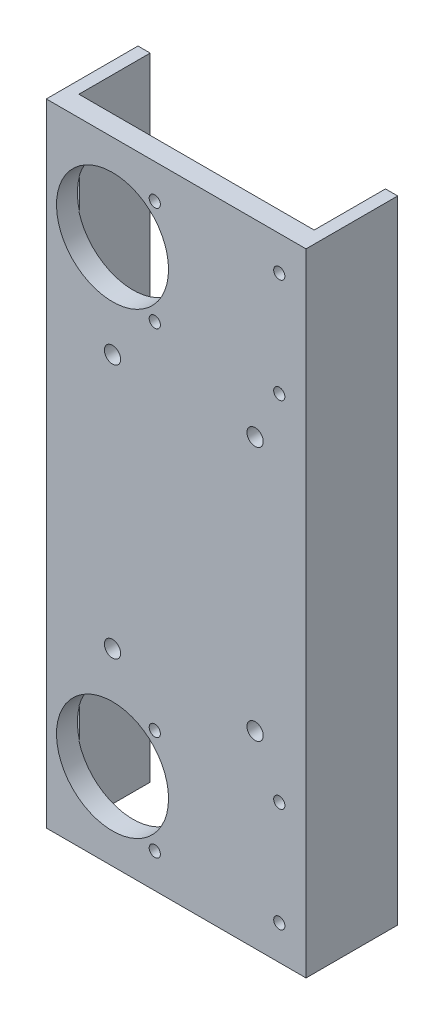
from build123d import *

# Parameters (mm, degrees)
S_BOX1_W      = 51
S_BOX1_H      = 124
BOSS_1_DEPTH  = 4
S_BOX2_W      = 2.4
S_BOX2_H      = 124
BOSS_2_DEPTH  = 14.5
S_BOX3_W      = 2.4
S_BOX3_H      = 124
BOSS_3_DEPTH  = 14.5
S_HOLE4_R     = 11
HOLE_4_DEPTH  = 4.2
S_HOLE5_R     = 1.1
HOLE_5_DEPTH  = 4.2
S_HOLE6_R     = 1.1
HOLE_6_DEPTH  = 4.2
S_HOLE7_R     = 1.1
HOLE_7_DEPTH  = 4.2
S_HOLE8_R     = 1.1
HOLE_8_DEPTH  = 4.2
S_HOLE9_R     = 11
HOLE_9_DEPTH  = 4.2
S_HOLE10_R    = 1.1
HOLE_10_DEPTH = 4.2
S_HOLE11_R    = 1.1
HOLE_11_DEPTH = 4.2
S_HOLE12_R    = 1.1
HOLE_12_DEPTH = 4.2
S_HOLE13_R    = 1.1
HOLE_13_DEPTH = 4.2
S_HOLE14_R    = 1.6
HOLE_14_DEPTH = 4.2
S_HOLE15_R    = 1.6
HOLE_15_DEPTH = 4.2
S_HOLE16_R    = 1.6
HOLE_16_DEPTH = 4.2
S_HOLE17_R    = 1.6
HOLE_17_DEPTH = 4.2


with BuildPart() as part:
    # S_box1 → Boss_1 (new body)
    with BuildSketch(Plane.XY.offset(64.625)):
        with Locations((12.5, 0)):
            Rectangle(S_BOX1_W, S_BOX1_H)
    extrude(amount=BOSS_1_DEPTH)

    # S_box2 → Boss_2 (add)
    with BuildSketch(Plane.XY.offset(50.625)):
        with Locations((-11.8, 0)):
            Rectangle(S_BOX2_W, S_BOX2_H)
    extrude(amount=BOSS_2_DEPTH)

    # S_box3 → Boss_3 (add)
    with BuildSketch(Plane.XY.offset(50.625)):
        with Locations((36.8, 0)):
            Rectangle(S_BOX3_W, S_BOX3_H)
    extrude(amount=BOSS_3_DEPTH)

    # S_hole4 → Hole_4 (cut)
    with BuildSketch(Plane.XY.offset(64.525)):
        with Locations((0, 45)):
            Circle(S_HOLE4_R)
    extrude(amount=HOLE_4_DEPTH, mode=Mode.SUBTRACT)

    # S_hole5 → Hole_5 (cut)
    with BuildSketch(Plane.XY.offset(64.525)):
        with Locations((8.3, 34.75)):
            Circle(S_HOLE5_R)
    extrude(amount=HOLE_5_DEPTH, mode=Mode.SUBTRACT)

    # S_hole6 → Hole_6 (cut)
    with BuildSketch(Plane.XY.offset(64.525)):
        with Locations((8.3, 55.25)):
            Circle(S_HOLE6_R)
    extrude(amount=HOLE_6_DEPTH, mode=Mode.SUBTRACT)

    # S_hole7 → Hole_7 (cut)
    with BuildSketch(Plane.XY.offset(64.525)):
        with Locations((32.75, 34.75)):
            Circle(S_HOLE7_R)
    extrude(amount=HOLE_7_DEPTH, mode=Mode.SUBTRACT)

    # S_hole8 → Hole_8 (cut)
    with BuildSketch(Plane.XY.offset(64.525)):
        with Locations((32.75, 55.25)):
            Circle(S_HOLE8_R)
    extrude(amount=HOLE_8_DEPTH, mode=Mode.SUBTRACT)

    # S_hole9 → Hole_9 (cut)
    with BuildSketch(Plane.XY.offset(64.525)):
        with Locations((0, -45)):
            Circle(S_HOLE9_R)
    extrude(amount=HOLE_9_DEPTH, mode=Mode.SUBTRACT)

    # S_hole10 → Hole_10 (cut)
    with BuildSketch(Plane.XY.offset(64.525)):
        with Locations((8.3, -55.25)):
            Circle(S_HOLE10_R)
    extrude(amount=HOLE_10_DEPTH, mode=Mode.SUBTRACT)

    # S_hole11 → Hole_11 (cut)
    with BuildSketch(Plane.XY.offset(64.525)):
        with Locations((8.3, -34.75)):
            Circle(S_HOLE11_R)
    extrude(amount=HOLE_11_DEPTH, mode=Mode.SUBTRACT)

    # S_hole12 → Hole_12 (cut)
    with BuildSketch(Plane.XY.offset(64.525)):
        with Locations((32.75, -55.25)):
            Circle(S_HOLE12_R)
    extrude(amount=HOLE_12_DEPTH, mode=Mode.SUBTRACT)

    # S_hole13 → Hole_13 (cut)
    with BuildSketch(Plane.XY.offset(64.525)):
        with Locations((32.75, -34.75)):
            Circle(S_HOLE13_R)
    extrude(amount=HOLE_13_DEPTH, mode=Mode.SUBTRACT)

    # S_hole14 → Hole_14 (cut)
    with BuildSketch(Plane.XY.offset(64.525)):
        with Locations((0, -25)):
            Circle(S_HOLE14_R)
    extrude(amount=HOLE_14_DEPTH, mode=Mode.SUBTRACT)

    # S_hole15 → Hole_15 (cut)
    with BuildSketch(Plane.XY.offset(64.525)):
        with Locations((0, 25)):
            Circle(S_HOLE15_R)
    extrude(amount=HOLE_15_DEPTH, mode=Mode.SUBTRACT)

    # S_hole16 → Hole_16 (cut)
    with BuildSketch(Plane.XY.offset(64.525)):
        with Locations((28, -25)):
            Circle(S_HOLE16_R)
    extrude(amount=HOLE_16_DEPTH, mode=Mode.SUBTRACT)

    # S_hole17 → Hole_17 (cut)
    with BuildSketch(Plane.XY.offset(64.525)):
        with Locations((28, 25)):
            Circle(S_HOLE17_R)
    extrude(amount=HOLE_17_DEPTH, mode=Mode.SUBTRACT)


solid = part.part
